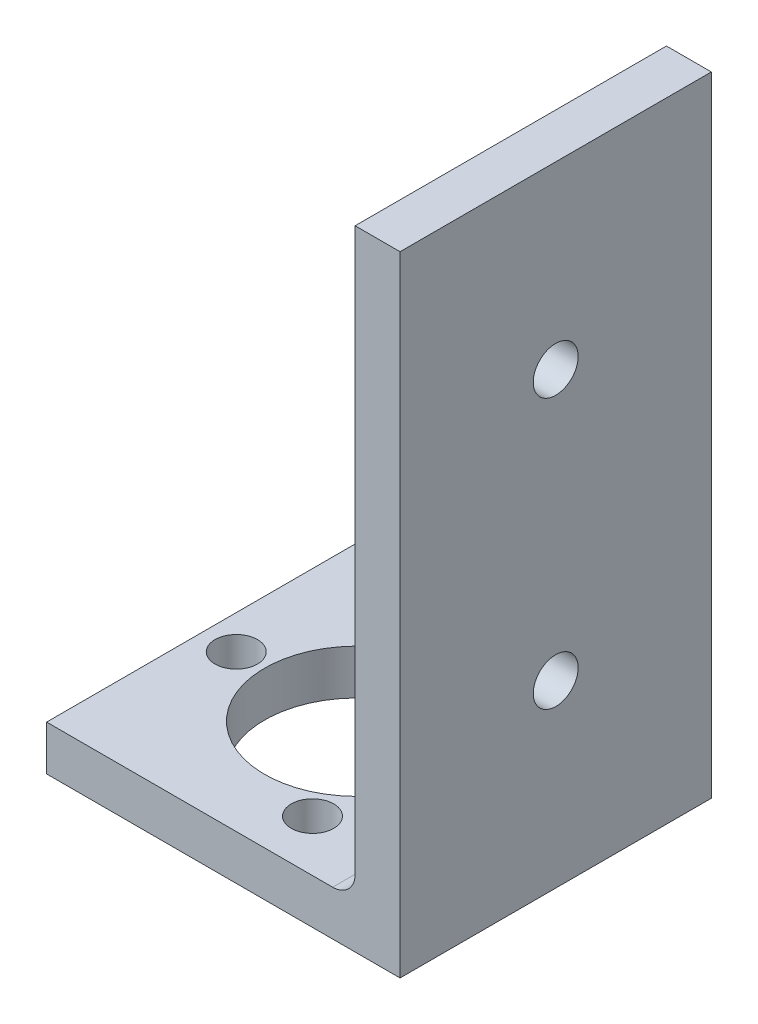
from build123d import *

# Parameters (mm, degrees)
BOSS_EXTRUDE1_DEPTH = 11
FILLET1_R           = 1.5875
SKETCH3_W           = 24.423912887
SKETCH3_H           = 26.552361768
CUT_EXTRUDE1_DEPTH  = 61.908127536
SKETCH4_R           = 1.5
SKETCH4_R_2         = 6.5
SKETCH4_W           = 25.825
SKETCH4_H           = 22
CUT_EXTRUDE2_DEPTH  = 53.363751775
SKETCH5_R           = 1.5875
CUT_EXTRUDE3_DEPTH  = 53.158921816


with BuildPart() as part:
    # Sketch2 → Boss-Extrude1 (new, symmetric)
    with BuildSketch(Plane.XY):
        Polygon((-25.4, 0), (25.4, 0), (25.4, 50.8), (22.225, 50.8), (22.225, 3.175), (-25.4, 3.175), align=None)
    extrude(amount=BOSS_EXTRUDE1_DEPTH, both=True)

    # Fillet1
    fillet1_edges = [part.edges().sort_by_distance(p)[0] for p in [
        (22.225, 3.175, 0),
    ]]
    fillet(fillet1_edges, radius=FILLET1_R)

    # Sketch3 → Cut-Extrude1 (cut, through all)
    with BuildSketch(Plane.XY.offset(11)):
        with Locations((18.271034128, 57.726180884)):
            Rectangle(SKETCH3_W, SKETCH3_H)
    extrude(amount=-CUT_EXTRUDE1_DEPTH, mode=Mode.SUBTRACT)

    # Sketch4 → Cut-Extrude2 (cut, through all)
    with BuildSketch(Plane.XZ):
        with Locations((15.575, -7.361215932)):
            Circle(SKETCH4_R)
        with Locations((11.325, 0)):
            Circle(SKETCH4_R_2)
        with Locations((15.575, 7.361215932)):
            Circle(SKETCH4_R)
        with Locations((-12.4875, 0)):
            Rectangle(SKETCH4_W, SKETCH4_H)
        with Locations((2.825, 0)):
            Circle(SKETCH4_R)
    extrude(amount=-CUT_EXTRUDE2_DEPTH, mode=Mode.SUBTRACT)

    # Sketch5 → Cut-Extrude3 (cut, through all)
    with BuildSketch(Plane(origin=(25.4, 0, 0), x_dir=(0, 0, -1), z_dir=(1, 0, 0))):
        with Locations((0, 31.75)):
            Circle(SKETCH5_R)
        with Locations((0, 12.7)):
            Circle(SKETCH5_R)
    extrude(amount=-CUT_EXTRUDE3_DEPTH, mode=Mode.SUBTRACT)


solid = part.part
